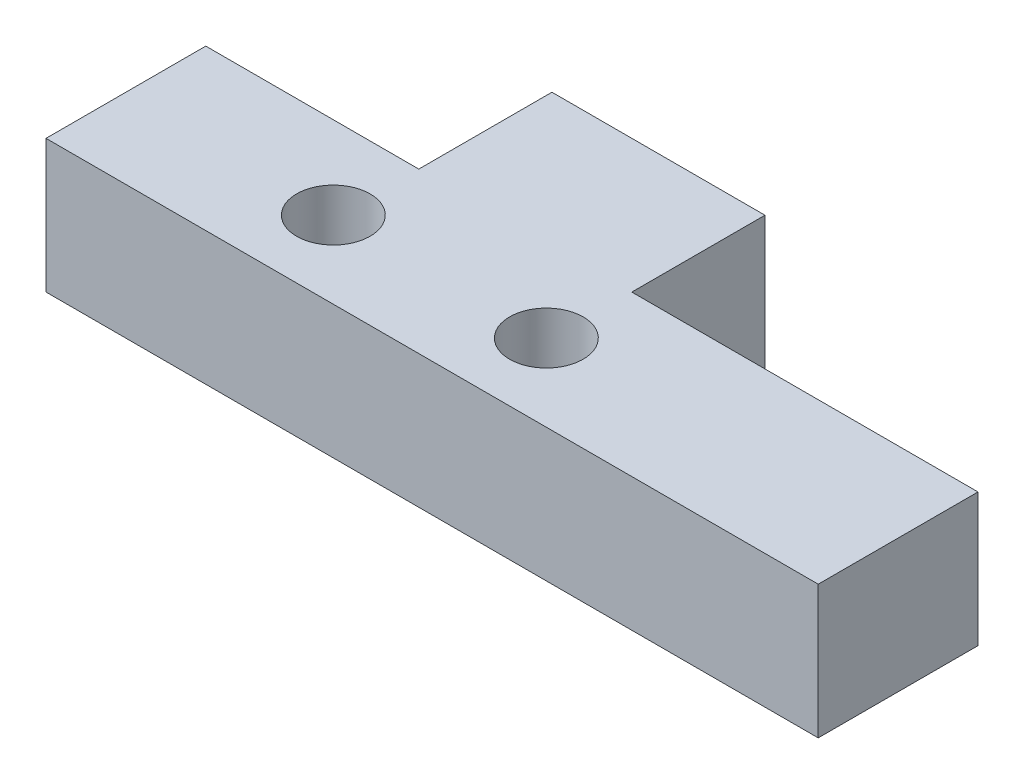
from build123d import *

# Parameters (mm, degrees)
SKETCH1_W           = 30.48
SKETCH1_H           = 7.62
BOSS_EXTRUDE1_DEPTH = 3.175
SKETCH2_W           = 10.16
SKETCH2_H           = 6.35
BOSS_EXTRUDE2_DEPTH = 6.35
SKETCH3_W           = 6.35
SKETCH3_H           = 7.62
BOSS_EXTRUDE3_DEPTH = 6.35
SKETCH6_R           = 1.7526
CUT_EXTRUDE1_DEPTH  = 25.691622061


with BuildPart() as part:
    # Sketch1 → Boss-Extrude1 (new, symmetric)
    with BuildSketch(Plane(origin=(0, 0, 0), x_dir=(1, 0, 0), z_dir=(0, 1, 0))):
        Rectangle(SKETCH1_W, SKETCH1_H)
    extrude(amount=BOSS_EXTRUDE1_DEPTH, both=True)

    # Sketch2 → Boss-Extrude2 (add)
    with BuildSketch(Plane(origin=(0, 3.175, 0), x_dir=(1, 0, 0), z_dir=(0, 1, 0))):
        with Locations((0, 6.985)):
            Rectangle(SKETCH2_W, SKETCH2_H)
    extrude(amount=-BOSS_EXTRUDE2_DEPTH)

    # Sketch3 → Boss-Extrude3 (add)
    with BuildSketch(Plane(origin=(0, 3.175, 0), x_dir=(1, 0, 0), z_dir=(0, 1, 0))):
        with Locations((18.415, 0)):
            Rectangle(SKETCH3_W, SKETCH3_H)
    extrude(amount=-BOSS_EXTRUDE3_DEPTH)

    # Sketch6 → Cut-Extrude1 (cut, through all)
    with BuildSketch(Plane.XZ.offset(3.175)):
        with Locations((4.941550795, 0.127)):
            Circle(SKETCH6_R)
        with Locations((-5.218449205, 0.127)):
            Circle(SKETCH6_R)
    extrude(amount=-CUT_EXTRUDE1_DEPTH, mode=Mode.SUBTRACT)


solid = part.part
